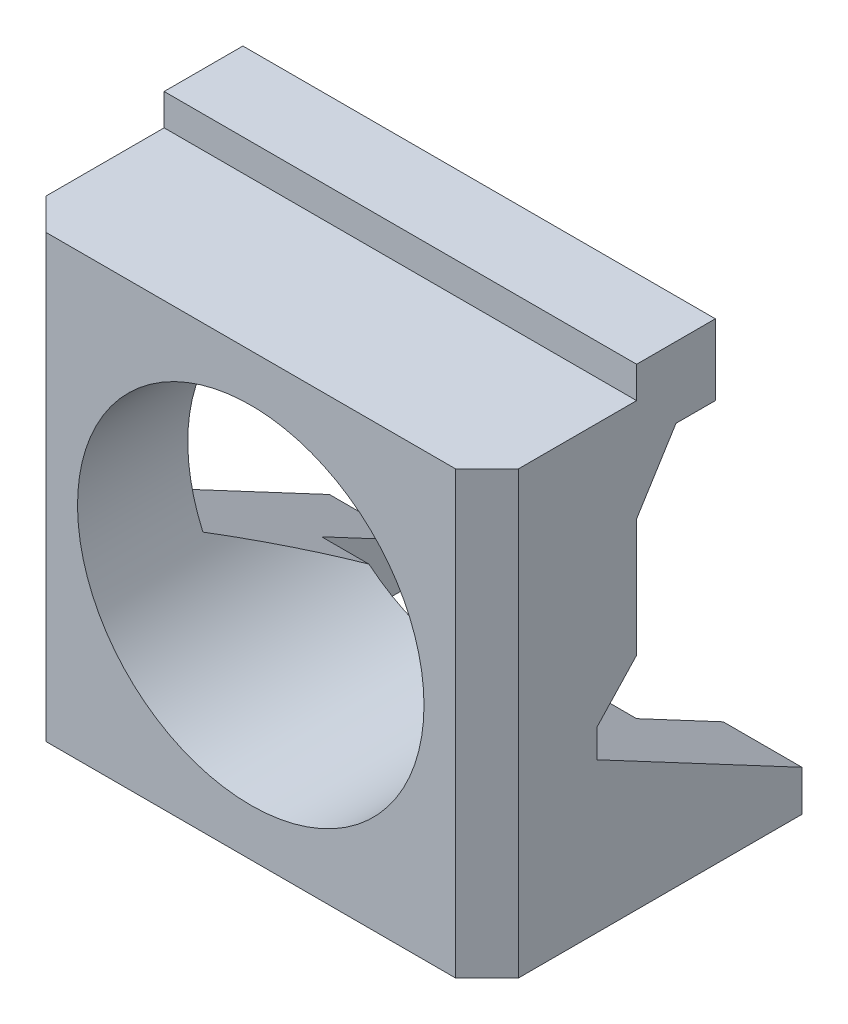
from build123d import *

# Parameters (mm, degrees)
SKETCH1_W           = 30
SKETCH1_H           = 28
SKETCH1_R           = 11
BOSS_EXTRUDE1_DEPTH = 7
SKETCH2_W           = 5
SKETCH2_H           = 2.5
BOSS_EXTRUDE2_DEPTH = 13
CHAMFER2_SIZE       = 2
BOSS_EXTRUDE6_DEPTH = 2.5
CHAMFER3_SIZE       = 2
CHAMFER4_SIZE       = 2
BOSS_EXTRUDE4_DEPTH = 2.5
CHAMFER6_SIZE       = 2.5
CHAMFER7_SIZE       = 7
CHAMFER7_SIZE_2     = 13.165085257
SKETCH7_R           = 1.5
CUT_EXTRUDE2_DEPTH  = 6.4
BOSS_EXTRUDE7_START = -2.5
SKETCH8_W           = 30
SKETCH8_H           = 5
BOSS_EXTRUDE7_DEPTH = 4.5
CHAMFER8_SIZE       = 4.000836323
CHAMFER8_SIZE_2     = 2.5


with BuildPart() as part:
    # Sketch1 → Boss-Extrude1 (new body)
    with BuildSketch(Plane.XY):
        Rectangle(SKETCH1_W, SKETCH1_H)
        Circle(SKETCH1_R, mode=Mode.SUBTRACT)
    extrude(amount=BOSS_EXTRUDE1_DEPTH)

    # Sketch2 → Boss-Extrude2 (add)
    with BuildSketch(Plane(origin=(0, 0, 0), x_dir=(-1, 0, 0), z_dir=(0, 0, -1))):
        with Locations((-12.5, -12.75)):
            Rectangle(SKETCH2_W, SKETCH2_H)
        with Locations((12.5, -12.75)):
            Rectangle(SKETCH2_W, SKETCH2_H)
    extrude(amount=BOSS_EXTRUDE2_DEPTH)

    # Chamfer2
    chamfer2_edges = [part.edges().sort_by_distance(p)[0] for p in [
        (-10, -12.75, 0),
        (10, -12.75, 0),
    ]]
    chamfer(chamfer2_edges, length=CHAMFER2_SIZE)

    # Sketch5 → Boss-Extrude6 (add)
    with BuildSketch(Plane.XZ.offset(14)):
        Polygon((-10, -2), (-10, -7.5), (10, -7.5), (10, -2), (8, 0), (-8, 0), align=None)
    extrude(amount=-BOSS_EXTRUDE6_DEPTH)

    # Chamfer3
    chamfer3_edges = [part.edges().sort_by_distance(p)[0] for p in [
        (15, 0, 7),
    ]]
    chamfer(chamfer3_edges, length=CHAMFER3_SIZE)

    # Chamfer4
    chamfer4_edges = [part.edges().sort_by_distance(p)[0] for p in [
        (-15, 0, 7),
    ]]
    chamfer(chamfer4_edges, length=CHAMFER4_SIZE)

    # Sketch4 → Boss-Extrude4 (add)
    with BuildSketch(Plane(origin=(0, 0, 0), x_dir=(-1, 0, 0), z_dir=(0, 0, -1))):
        Polygon((-15, 0), (15, 11.5), (15, 14), (-15, 14), align=None)
    extrude(amount=BOSS_EXTRUDE4_DEPTH)

    # Chamfer6
    # the kernel refuses this chamfer: 2.5 mm, written as the material it adds along each edge
    with BuildSketch(Plane(origin=(21.003247512, -2.30124488, 0), x_dir=(-0.3578006820796162, -0.9333930836859554, 0.02749587661058638), z_dir=(-0.9337461173020497, 0.35793601163245237, 0))) as chamfer6_piece_1_section:
        Polygon((CHAMFER6_SIZE * 0.999621916911, -CHAMFER6_SIZE * 0.0274958766106), (-CHAMFER6_SIZE * 0.0274958766106, -CHAMFER6_SIZE * 0.999621916911), (0, 0), align=None)
    chamfer6_piece_1 = extrude(amount=17.263908412, mode=Mode.PRIVATE)
    chamfer6_piece_1 = chamfer6_piece_1 - Plane(origin=(0, 0, -0.835393566), x_dir=(1, 0, 0), z_dir=(0, 0, -1)) * Cylinder(11, 45, mode=Mode.PRIVATE)
    chamfer6_piece_1 = split(chamfer6_piece_1, bisect_by=Plane(origin=(15, -0.113968884, -0.835393566), z_dir=(-1, 0, 0)), keep=Keep.TOP, mode=Mode.PRIVATE)
    add(chamfer6_piece_1)
    with BuildSketch(Plane(origin=(-1.03959441, 6.148511191, 0), x_dir=(-0.35780068207961624, -0.9333930836859554, 0.02749587661058638), z_dir=(-0.9337461173020497, 0.35793601163245237, 0))) as chamfer6_piece_2_section:
        Polygon((CHAMFER6_SIZE * 0.999621916911, -CHAMFER6_SIZE * 0.0274958766106), (-CHAMFER6_SIZE * 0.0274958766106, -CHAMFER6_SIZE * 0.999621916911), (0, 0), align=None)
    chamfer6_piece_2 = extrude(amount=21.380172546, mode=Mode.PRIVATE)
    chamfer6_piece_2 = chamfer6_piece_2 - Plane(origin=(0, 0, -0.851534645), x_dir=(1, 0, 0), z_dir=(0, 0, -1)) * Cylinder(11, 53, mode=Mode.PRIVATE)
    chamfer6_piece_2 = split(chamfer6_piece_2, bisect_by=Plane(origin=(-15, 9.244820467, -0.851534645), z_dir=(1, 0, 0)), keep=Keep.TOP, mode=Mode.PRIVATE)
    add(chamfer6_piece_2)

    # Chamfer7
    # the kernel refuses this chamfer: 13.165085257, 7 mm, written as the material it adds along each edge
    with BuildSketch(Plane(origin=(-15, -11.5, 0), x_dir=(0, 0.9979482451756082, 0.06402577567608186), z_dir=(1, 0, 0))) as chamfer7_piece_1_section:
        Polygon((CHAMFER7_SIZE * 0.997948245176, -CHAMFER7_SIZE * 0.0640257756761), (-CHAMFER7_SIZE_2 * 0.0640257756781, -CHAMFER7_SIZE_2 * 0.997948245208), (0, 0), align=None)
    chamfer7_piece_1 = extrude(amount=30, mode=Mode.PRIVATE)
    chamfer7_piece_1 = chamfer7_piece_1 - Plane(origin=(0, 0, -3.073682767), x_dir=(1, 0, 0), z_dir=(0, 0, -1)) * Cylinder(11, 113, mode=Mode.PRIVATE)
    chamfer7_piece_1 = split(chamfer7_piece_1, bisect_by=Plane(origin=(-10, -8.887755394, -3.073682767), z_dir=(-1, 0, 0)), keep=Keep.TOP, mode=Mode.PRIVATE)
    chamfer7_piece_1 = split(chamfer7_piece_1, bisect_by=Plane(origin=(-12.500128058, -8.887755394, -7.5), z_dir=(0, 0, 1)), keep=Keep.TOP, mode=Mode.PRIVATE)
    add(chamfer7_piece_1)
    with BuildSketch(Plane(origin=(-15, -11.5, 0), x_dir=(0, 0.9979482451756082, 0.06402577567608186), z_dir=(1, 0, 0))) as chamfer7_piece_2_section:
        Polygon((CHAMFER7_SIZE * 0.997948245176, -CHAMFER7_SIZE * 0.0640257756761), (-CHAMFER7_SIZE_2 * 0.0640257756781, -CHAMFER7_SIZE_2 * 0.997948245208), (0, 0), align=None)
    chamfer7_piece_2 = extrude(amount=30, mode=Mode.PRIVATE)
    chamfer7_piece_2 = split(chamfer7_piece_2, bisect_by=Plane(origin=(-10, -10.721530873, -9.597564575), z_dir=(-1, 0, 0)), keep=Keep.TOP, mode=Mode.PRIVATE)
    chamfer7_piece_2 = split(chamfer7_piece_2, bisect_by=Plane(origin=(-12.5, -10.721530873, -7.5), z_dir=(0, 0, -1)), keep=Keep.TOP, mode=Mode.PRIVATE)
    chamfer7_piece_2 = split(chamfer7_piece_2, bisect_by=Plane(origin=(-12.5, -10.721530873, -13), z_dir=(0, 0, 1)), keep=Keep.TOP, mode=Mode.PRIVATE)
    add(chamfer7_piece_2)
    with BuildSketch(Plane(origin=(-15, -11.5, 0), x_dir=(0, 0.9979482451756082, 0.06402577567608186), z_dir=(1, 0, 0))) as chamfer7_piece_3_section:
        Polygon((CHAMFER7_SIZE * 0.997948245176, -CHAMFER7_SIZE * 0.0640257756761), (-CHAMFER7_SIZE_2 * 0.0640257756781, -CHAMFER7_SIZE_2 * 0.997948245208), (0, 0), align=None)
    chamfer7_piece_3 = extrude(amount=30, mode=Mode.PRIVATE)
    chamfer7_piece_3 = chamfer7_piece_3 - Plane(origin=(0, 0, -3.793876077), x_dir=(1, 0, 0), z_dir=(0, 0, -1)) * Cylinder(11, 113, mode=Mode.PRIVATE)
    chamfer7_piece_3 = split(chamfer7_piece_3, bisect_by=Plane(origin=(-10, -6.598719884, -3.793876077), z_dir=(1, 0, 0)), keep=Keep.TOP, mode=Mode.PRIVATE)
    chamfer7_piece_3 = split(chamfer7_piece_3, bisect_by=Plane(origin=(-9.499486782, -6.598719884, -7.5), z_dir=(0, 0, 1)), keep=Keep.TOP, mode=Mode.PRIVATE)
    chamfer7_piece_3 = split(chamfer7_piece_3, bisect_by=Plane(origin=(10, -6.598719884, -3.793876077), z_dir=(-1, 0, 0)), keep=Keep.TOP, mode=Mode.PRIVATE)
    add(chamfer7_piece_3)
    with BuildSketch(Plane(origin=(-15, -11.5, 0), x_dir=(0, 0.9979482451756082, 0.06402577567608186), z_dir=(1, 0, 0))) as chamfer7_piece_4_section:
        Polygon((CHAMFER7_SIZE * 0.997948245176, -CHAMFER7_SIZE * 0.0640257756761), (-CHAMFER7_SIZE_2 * 0.0640257756781, -CHAMFER7_SIZE_2 * 0.997948245208), (0, 0), align=None)
    chamfer7_piece_4 = extrude(amount=30, mode=Mode.PRIVATE)
    chamfer7_piece_4 = split(chamfer7_piece_4, bisect_by=Plane(origin=(12.5, -10.721530873, -7.5), z_dir=(0, 0, -1)), keep=Keep.TOP, mode=Mode.PRIVATE)
    chamfer7_piece_4 = split(chamfer7_piece_4, bisect_by=Plane(origin=(10, -10.721530873, -9.597564575), z_dir=(1, 0, 0)), keep=Keep.TOP, mode=Mode.PRIVATE)
    chamfer7_piece_4 = split(chamfer7_piece_4, bisect_by=Plane(origin=(12.5, -10.721530873, -13), z_dir=(0, 0, 1)), keep=Keep.TOP, mode=Mode.PRIVATE)
    add(chamfer7_piece_4)
    with BuildSketch(Plane(origin=(-15, -11.5, 0), x_dir=(0, 0.9979482451756082, 0.06402577567608186), z_dir=(1, 0, 0))) as chamfer7_piece_5_section:
        Polygon((CHAMFER7_SIZE * 0.997948245176, -CHAMFER7_SIZE * 0.0640257756761), (-CHAMFER7_SIZE_2 * 0.0640257756781, -CHAMFER7_SIZE_2 * 0.997948245208), (0, 0), align=None)
    chamfer7_piece_5 = extrude(amount=30, mode=Mode.PRIVATE)
    chamfer7_piece_5 = chamfer7_piece_5 - Plane(origin=(0, 0, -3.073682766), x_dir=(1, 0, 0), z_dir=(0, 0, -1)) * Cylinder(11, 113, mode=Mode.PRIVATE)
    chamfer7_piece_5 = split(chamfer7_piece_5, bisect_by=Plane(origin=(12.500128057, -8.887755394, -7.5), z_dir=(0, 0, 1)), keep=Keep.TOP, mode=Mode.PRIVATE)
    chamfer7_piece_5 = split(chamfer7_piece_5, bisect_by=Plane(origin=(10, -8.887755394, -3.073682766), z_dir=(1, 0, 0)), keep=Keep.TOP, mode=Mode.PRIVATE)
    add(chamfer7_piece_5)

    # Sketch7 → Cut-Extrude2 (cut)
    with BuildSketch(Plane.XZ.offset(14)):
        with Locations(Location((-11, 2.5, 0), (0, 0, 270))):
            Circle(SKETCH7_R)
        with Locations(Location((11, 2.5, 0), (0, 0, 270))):
            Circle(SKETCH7_R)
    extrude(amount=-CUT_EXTRUDE2_DEPTH, mode=Mode.SUBTRACT)

    # Sketch8 → Boss-Extrude7 (add)
    with BuildSketch(Plane(origin=(0, 14, 0), x_dir=(1, 0, 0), z_dir=(0, 1, 0)).offset(BOSS_EXTRUDE7_START)):
        with Locations((0, 5)):
            Rectangle(SKETCH8_W, SKETCH8_H)
    extrude(amount=BOSS_EXTRUDE7_DEPTH)

    # Chamfer8
    # the kernel refuses this chamfer: 4.000836323, 2.5 mm, written as the material it adds along each edge
    with BuildSketch(Plane(origin=(-25.343554005, 11.5, -2.5), x_dir=(0, -0.9997899140358645, 0.02049701910421793), z_dir=(1, 0, 0))) as chamfer8_piece_1_section:
        Polygon((CHAMFER8_SIZE * 0.999789913937, CHAMFER8_SIZE * 0.0204970191022), (-CHAMFER8_SIZE_2 * 0.0204970191042, CHAMFER8_SIZE_2 * 0.999789914036), (0, 0), align=None)
    chamfer8_piece_1 = extrude(amount=40.343554005, mode=Mode.PRIVATE)
    chamfer8_piece_1 = split(chamfer8_piece_1, bisect_by=Plane(origin=(2.975759377, 8.202968449, -5.855581208), z_dir=(0.25309898105600476, 0.6602582114512465, 0.707106781186274)), keep=Keep.TOP, mode=Mode.PRIVATE)
    add(chamfer8_piece_1)


solid = part.part
